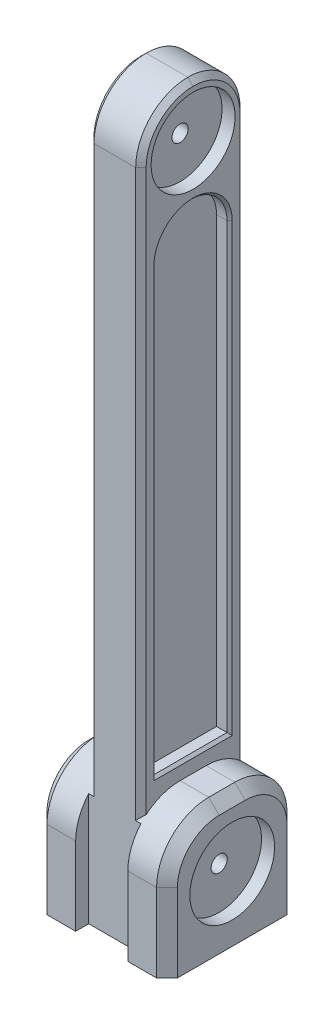
from build123d import *

# Parameters (mm, degrees)
BASE_W              = 10
BASE_H              = 20
BOSS_EXTRUDE1_DEPTH = 25
SKETCH2_R           = 8.125
SKETCH2_R_2         = 1.55
CUT_EXTRUDE1_DEPTH  = 2.5
SKETCH2_2_R         = 1.55
CUT_EXTRUDE2_DEPTH  = 38.5
BOSS_EXTRUDE2_START = 25
BASE_3_W            = 10
BASE_3_H            = 20
BOSS_EXTRUDE2_DEPTH = 115
BEARING_R           = 8.05
BEARING_R_2         = 1.55
CUT_EXTRUDE3_DEPTH  = 2.5
FILLET1_R           = 10
CHAMFER1_SIZE       = 2
CUT_EXTRUDE5_DEPTH  = 2.5
BEARING_2_R         = 1.55
CUT_EXTRUDE6_DEPTH  = 142.642154742
CHAMFER2_SIZE       = 1
CHAMFER3_SIZE       = 0.5


with BuildPart() as part:
    # Base → Boss-Extrude1 (new body)
    with BuildSketch(Plane(origin=(0, 0, 0), x_dir=(1, 0, 0), z_dir=(0, 1, 0))):
        Polygon((5, -12.5), (5, -10), (5, 10), (5, 12.5), (12.5, 12.5), (12.5, -12.5), align=None)
        Rectangle(BASE_W, BASE_H)
        Polygon((-5, 10), (-5, -10), (-5, -12.5), (-12.5, -12.5), (-12.5, 12.5), (-5, 12.5), align=None)
    extrude(amount=BOSS_EXTRUDE1_DEPTH)

    # Sketch2 → Cut-Extrude1 (cut)
    with BuildSketch(Plane.ZY.offset(12.5)):
        with Locations((0, 12.5)):
            Circle(SKETCH2_R)
        with Locations((0, 12.5)):
            Circle(SKETCH2_R_2, mode=Mode.SUBTRACT)
    cut_extrude1 = extrude(amount=-CUT_EXTRUDE1_DEPTH, mode=Mode.SUBTRACT)

    # Sketch2<2> → Cut-Extrude2 (cut, through all)
    with BuildSketch(Plane.ZY.offset(12.5)):
        with Locations((0, 12.5)):
            Circle(SKETCH2_2_R)
    extrude(amount=-CUT_EXTRUDE2_DEPTH, mode=Mode.SUBTRACT)

    # Base<3> → Boss-Extrude2 (add)
    with BuildSketch(Plane(origin=(0, 0, 0), x_dir=(1, 0, 0), z_dir=(0, 1, 0)).offset(BOSS_EXTRUDE2_START)):
        Rectangle(BASE_3_W, BASE_3_H)
    extrude(amount=BOSS_EXTRUDE2_DEPTH)

    # Mirror1: Cut-Extrude1 across plane
    add(cut_extrude1.mirror(Plane.ZY), mode=Mode.SUBTRACT)

    # Bearing → Cut-Extrude3 (cut)
    with BuildSketch(Plane.ZY.offset(5)):
        with Locations((0, 129.95)):
            Circle(BEARING_R)
        with Locations((0, 129.95)):
            Circle(BEARING_R_2, mode=Mode.SUBTRACT)
    cut_extrude3 = extrude(amount=-CUT_EXTRUDE3_DEPTH, mode=Mode.SUBTRACT)

    # Fillet1
    # the kernel refuses this fillet: 10 mm, written as the material it takes off along each edge
    with BuildSketch(Plane(origin=(37.5, 25, 12.5), x_dir=(0, -1, 0), z_dir=(-1, 0, 0)), Plane(origin=(5, 25, -12.5), x_dir=(0, -1, 0), z_dir=(1, 0, 0))) as fillet1_piece_1:
        with BuildLine():
            CenterArc((FILLET1_R, -FILLET1_R), FILLET1_R, 90, 90)
            Line((0, -FILLET1_R), (0, 0))
            Line((0, 0), (FILLET1_R, 0))
        make_face()
    extrude(amount=32.5, mode=Mode.SUBTRACT)
    with BuildSketch(Plane(origin=(37.5, 25, 12.5), x_dir=(0, -1, 0), z_dir=(-1, 0, 0))) as fillet1_piece_2_section:
        with BuildLine():
            CenterArc((FILLET1_R, -FILLET1_R), FILLET1_R, 90, 90)
            Line((0, -FILLET1_R), (0, 0))
            Line((0, 0), (FILLET1_R, 0))
        make_face()
    fillet1_piece_2 = extrude(amount=57.5, mode=Mode.PRIVATE)
    fillet1_piece_2 = split(fillet1_piece_2, bisect_by=Plane(origin=(-5, 22.736048857, 10.236048857), z_dir=(-1, 0, 0)), keep=Keep.TOP, mode=Mode.PRIVATE)
    add(fillet1_piece_2, mode=Mode.SUBTRACT)
    with BuildSketch(Plane(origin=(-20, 25, -12.5), x_dir=(0, -1, 0), z_dir=(1, 0, 0))) as fillet1_piece_3_section:
        with BuildLine():
            CenterArc((FILLET1_R, -FILLET1_R), FILLET1_R, 90, 90)
            Line((0, -FILLET1_R), (0, 0))
            Line((0, 0), (FILLET1_R, 0))
        make_face()
    fillet1_piece_3 = extrude(amount=57.5, mode=Mode.PRIVATE)
    fillet1_piece_3 = split(fillet1_piece_3, bisect_by=Plane(origin=(-5, 22.736048857, -10.236048857), z_dir=(-1, 0, 0)), keep=Keep.TOP, mode=Mode.PRIVATE)
    add(fillet1_piece_3, mode=Mode.SUBTRACT)
    with BuildSketch(Plane(origin=(-37.5, 25, -12.5), x_dir=(0, 0, 1), z_dir=(1, 0, 0)), Plane(origin=(-5, 25, 12.5), x_dir=(0, 0, -1), z_dir=(-1, 0, 0))) as fillet1_piece_4:
        with BuildLine():
            CenterArc((FILLET1_R, FILLET1_R), FILLET1_R, 180, 90)
            Line((0, FILLET1_R), (0, 0))
            Line((0, 0), (FILLET1_R, 0))
        make_face()
    extrude(amount=32.5, mode=Mode.SUBTRACT)
    with BuildSketch(Plane(origin=(-37.5, 25, -12.5), x_dir=(0, 0, 1), z_dir=(1, 0, 0))) as fillet1_piece_5_section:
        with BuildLine():
            CenterArc((FILLET1_R, FILLET1_R), FILLET1_R, 180, 90)
            Line((0, FILLET1_R), (0, 0))
            Line((0, 0), (FILLET1_R, 0))
        make_face()
    fillet1_piece_5 = extrude(amount=57.5, mode=Mode.PRIVATE)
    fillet1_piece_5 = split(fillet1_piece_5, bisect_by=Plane(origin=(5, 22.736048857, -10.236048857), z_dir=(1, 0, 0)), keep=Keep.TOP, mode=Mode.PRIVATE)
    add(fillet1_piece_5, mode=Mode.SUBTRACT)
    with BuildSketch(Plane(origin=(20, 25, 12.5), x_dir=(0, 0, -1), z_dir=(-1, 0, 0))) as fillet1_piece_6_section:
        with BuildLine():
            CenterArc((FILLET1_R, FILLET1_R), FILLET1_R, 180, 90)
            Line((0, FILLET1_R), (0, 0))
            Line((0, 0), (FILLET1_R, 0))
        make_face()
    fillet1_piece_6 = extrude(amount=57.5, mode=Mode.PRIVATE)
    fillet1_piece_6 = split(fillet1_piece_6, bisect_by=Plane(origin=(5, 22.736048857, 10.236048857), z_dir=(1, 0, 0)), keep=Keep.TOP, mode=Mode.PRIVATE)
    add(fillet1_piece_6, mode=Mode.SUBTRACT)
    with BuildSketch(Plane(origin=(30, 140, 10), x_dir=(0, -1, 0), z_dir=(-1, 0, 0)), Plane(origin=(-30, 140, -10), x_dir=(0, -1, 0), z_dir=(1, 0, 0))) as fillet1_piece_7:
        with BuildLine():
            CenterArc((FILLET1_R, -FILLET1_R), FILLET1_R, 90, 90)
            Line((0, -FILLET1_R), (0, 0))
            Line((0, 0), (FILLET1_R, 0))
        make_face()
    extrude(amount=60, mode=Mode.SUBTRACT)

    # Chamfer1
    chamfer1_edges = [part.edges().sort_by_distance(p)[0] for p in [
        (12.5, 7.5, -12.5),
        (12.5, 25, 0),
        (12.5, 7.5, 12.5),
        (12.5, 22.071067812, 9.571067812),
        (12.5, 22.071067812, -9.571067812),
        (-12.5, 25, 0),
        (-12.5, 7.5, 12.5),
        (-12.5, 7.5, -12.5),
        (-12.5, 22.071067812, 9.571067812),
        (-12.5, 22.071067812, -9.571067812),
    ]]
    chamfer(chamfer1_edges, length=CHAMFER1_SIZE)

    # Sketch4 → Cut-Extrude5 (cut)
    with BuildSketch(Plane(origin=(5, 0, 0), x_dir=(0, 0, -1), z_dir=(1, 0, 0))):
        with BuildLine():
            Line((-7, 28), (7, 28))
            Line((7, 28), (7, 112.95))
            ThreePointArc((7, 112.95), (0, 119.95), (-7, 112.95))
            Line((-7, 112.95), (-7, 28))
        make_face()
    cut_extrude5 = extrude(amount=-CUT_EXTRUDE5_DEPTH, mode=Mode.SUBTRACT)

    # Mirror2: Cut-Extrude3, Cut-Extrude5 across plane
    add(cut_extrude3.mirror(Plane.ZY), mode=Mode.SUBTRACT)
    add(cut_extrude5.mirror(Plane.ZY), mode=Mode.SUBTRACT)

    # Bearing<2> → Cut-Extrude6 (cut, through all)
    with BuildSketch(Plane.ZY.offset(5)):
        with Locations((0, 129.95)):
            Circle(BEARING_2_R)
    extrude(amount=-CUT_EXTRUDE6_DEPTH, mode=Mode.SUBTRACT)

    # Chamfer2
    chamfer2_edges = [part.edges().sort_by_distance(p)[0] for p in [
        (5, 140, 0),
        (5, 140, 0),
        (5, 75.807189139, 10),
        (-5, 75.807189139, 10),
        (-5, 75.807189139, -10),
        (5, 75.807189139, -10),
        (-5, 140, 0),
        (-5, 140, 0),
    ]]
    chamfer(chamfer2_edges, length=CHAMFER2_SIZE)

    # Chamfer3
    chamfer3_edges = [part.edges().sort_by_distance(p)[0] for p in [
        (5, 119.95, 0),
        (5, 70.475, 7),
        (5, 28, 0),
        (5, 70.475, -7),
        (-5, 119.95, 0),
        (-5, 70.475, 7),
        (-5, 28, 0),
        (-5, 70.475, -7),
    ]]
    chamfer(chamfer3_edges, length=CHAMFER3_SIZE)


solid = part.part
